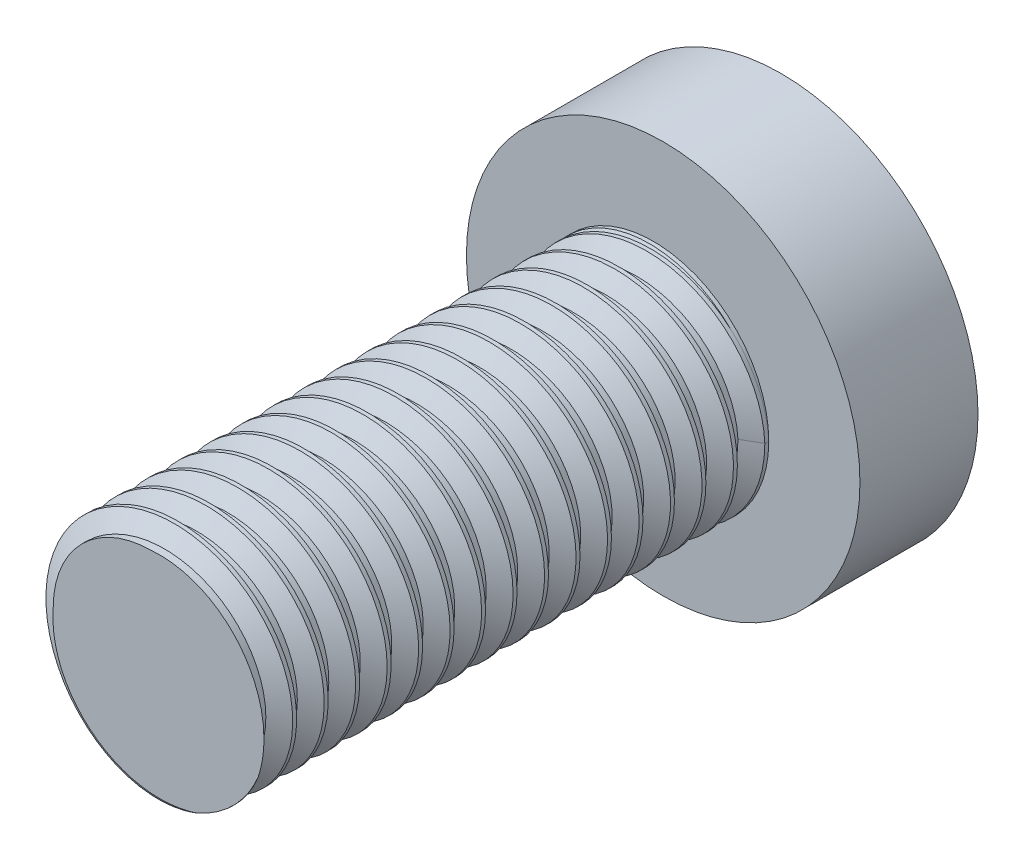
from build123d import *
from build123d.topology import SkipClean

# Parameters (mm, degrees)
SKETCH1_R           = 5
BOSS_EXTRUDE1_DEPTH = 1.5
SKETCH1_3_R         = 2.5
BOSS_EXTRUDE2_DEPTH = 14.5
CUT_EXTRUDE1_DEPTH  = 2.5
THREAD1_PITCH       = 0.8
CUT_EXTRUDE2_START  = 5
SKETCH11_R          = 5
CUT_EXTRUDE2_DEPTH  = 5


with BuildPart() as part:
    # Sketch1 → Boss-Extrude1 (new, symmetric)
    with BuildSketch(Plane.XY):
        Circle(SKETCH1_R)
    extrude(amount=BOSS_EXTRUDE1_DEPTH, both=True)

    # Sketch1<3> → Boss-Extrude2 (add)
    with BuildSketch(Plane.XY):
        with Locations(Location((0, 0, 0), (0, 0, 180))):
            Circle(SKETCH1_3_R)
    extrude(amount=BOSS_EXTRUDE2_DEPTH)

    # Sketch3 → Cut-Extrude1 (cut)
    with BuildSketch(Plane(origin=(0, 0, -1.5), x_dir=(-1, 0, 0), z_dir=(0, 0, -1))):
        Polygon((0, 2.886751346), (-2.5, 1.443375673), (-2.5, -1.443375673), (0, -2.886751346), (2.5, -1.443375673), (2.5, 1.443375673), align=None)
    extrude(amount=-CUT_EXTRUDE1_DEPTH, mode=Mode.SUBTRACT)

    # Thread1: the profile of Thread Profile2 profile screwed along a right-hand helix of 18.75 turns, 8 arcs to a turn; built about Z, then put on its axis
    with SkipClean():  # the faces are left unmerged after this step: merging them gives an invalid solid
        thread1_z = Axis((0, 0, 0), (0, 0, 1))
        thread1_corners = [(2.4997, 0, -0.000173205), (2.9330127, 0, 0.249999999), (2.9330127, 0, 0.349999999), (2.4997, 0, 0.600173203)]
        with BuildLine(mode=Mode.PRIVATE) as thread1_profile:
            Line(thread1_corners[0], thread1_corners[1])
            Line(thread1_corners[1], thread1_corners[2])
            Line(thread1_corners[2], thread1_corners[3])
            Line(thread1_corners[3], thread1_corners[0])
        thread1_cap = Face(thread1_profile.wire())
        thread1_turn_angles = [0, 22.5, 45, 67.5, 90, 112.5, 135, 157.5, 180, 202.5, 225, 247.5, 270, 292.5, 315, 337.5, 360]
        thread1_turn_weights = [1, 0.9238795325112867, 1, 0.9238795325112867, 1, 0.9238795325112867, 1, 0.9238795325112867, 1, 0.9238795325112867, 1, 0.9238795325112867, 1, 0.9238795325112867, 1, 0.9238795325112867, 1]
        thread1_turn_rails = [Edge.make_bspline([Vector(p[0], p[1], 0).rotate(thread1_z, thread1_turn_angles[k]) / thread1_turn_weights[k] + Vector(0, 0, p[2] + THREAD1_PITCH * thread1_turn_angles[k] / 360) for k in range(17)], [0, 0, 0, 1, 1, 2, 2, 3, 3, 4, 4, 5, 5, 6, 6, 7, 7, 8, 8, 8], 2, thread1_turn_weights) for p in thread1_corners]
        thread1_turn_sides = [Face.make_surface_from_curves(thread1_turn_rails[p[0]], thread1_turn_rails[p[1]]) for p in [(0, 1), (1, 2), (2, 3), (3, 0)]]
        thread1_last_angles = [6480, 6502.5, 6525, 6547.5, 6570, 6592.5, 6615, 6637.5, 6660, 6682.5, 6705, 6727.5, 6750]
        thread1_last_weights = [1, 0.9238795325112867, 1, 0.9238795325112867, 1, 0.9238795325112867, 1, 0.9238795325112867, 1, 0.9238795325112867, 1, 0.9238795325112867, 1]
        thread1_last_rails = [Edge.make_bspline([Vector(p[0], p[1], 0).rotate(thread1_z, thread1_last_angles[k]) / thread1_last_weights[k] + Vector(0, 0, p[2] + THREAD1_PITCH * thread1_last_angles[k] / 360) for k in range(13)], [0, 0, 0, 1, 1, 2, 2, 3, 3, 4, 4, 5, 5, 6, 6, 6], 2, thread1_last_weights) for p in thread1_corners]
        thread1_last_sides = [Face.make_surface_from_curves(thread1_last_rails[p[0]], thread1_last_rails[p[1]]) for p in [(0, 1), (1, 2), (2, 3), (3, 0)]]
        thread1 = Plane(origin=(0, 0, 1.5), x_dir=(1, 0, 0), z_dir=(0, 0, 1)) * Solid(Shell([*[p.moved(Location((0, 0, THREAD1_PITCH * i))) for i in range(18) for p in thread1_turn_sides], *thread1_last_sides, thread1_cap, thread1_cap.rotate(thread1_z, 6750).moved(Location((0, 0, THREAD1_PITCH * 6750 / 360)))]))
        add(thread1)

    # Sketch11 → Cut-Extrude2 (cut)
    with SkipClean():  # the faces are left unmerged after this step: merging them gives an invalid solid
        with BuildSketch(Plane.XY.offset(14.5).offset(CUT_EXTRUDE2_START)):
            Circle(SKETCH11_R)
        extrude(amount=-CUT_EXTRUDE2_DEPTH, mode=Mode.SUBTRACT)

    # Sketch12 → Revolve1 (revolve)
    with BuildSketch(Plane.XZ):
        Polygon((2.9330127, 1.749999999), (2.9330127, 1.849999999), (2.5, 2.099999998), (2.5, 1.5), align=None)
    revolve(axis=Axis((0, 0, 1.5), (0, 0, -1)))


solid = part.part
